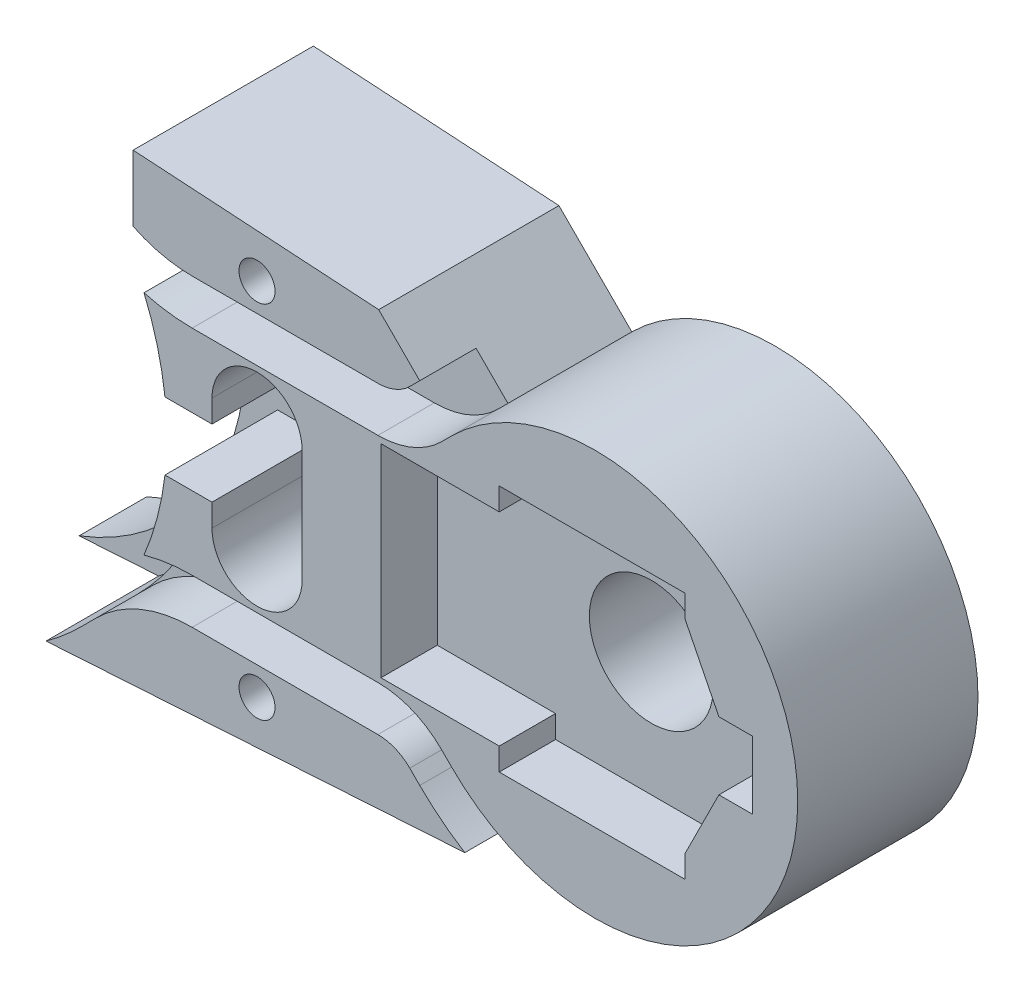
from build123d import *

# Parameters (mm, degrees)
SKETCH1_R                   = 2.75
BOSS_EXTRUDE1_DEPTH         = 8
POT_START                   = 8
POT_INSERT_DEPTH            = 2.5
MIDDLE_START                = 3
SKETCH7_R                   = 11
MIDDLE_FLEX_EXT_CANAL_DEPTH = 5
DISTAL_START                = 5.5
DISTAL_FLEX_EXT_CANAL_DEPTH = 2.5
SKETCH3_R                   = 0.8
SCREW_HOLES_DEPTH           = 44.132654063


with BuildPart() as part:
    # Sketch1 → Boss-Extrude1 (new body)
    with BuildSketch(Plane.XY):
        with BuildLine():
            Line((11.5, 10.28125), (11.5, 0))
            ThreePointArc((11.5, 0), (9.471532219, -6.522275479), (4.101725666, -10.743642146))
            Line((4.101725666, -10.743642146), (32, -9))
            ThreePointArc((32, -9), (40.314915793, 3.444150891), (25.636038969, 6.363961031))
            Line((25.636038969, 6.363961031), (22.4, 9.6))
            Line((22.4, 9.6), (11.5, 10.28125))
        make_face()
        with Locations((32, 0)):
            Circle(SKETCH1_R, mode=Mode.SUBTRACT)
    extrude(amount=BOSS_EXTRUDE1_DEPTH)

    # Sketch2 → Pot Insert (cut)
    with BuildSketch(Plane(origin=(28.28760271, 0, 0), x_dir=(1, 0, 0), z_dir=(0, 0, 1)).offset(POT_START)):
        Polygon((10.71239729, 0), (10.71239729, 1.5), (9.21239729, 1.5), (7.71239729, 4.5), (7.71239729, 5.5), (3.71239729, 5.5), (-0.53760271, 5.5), (-0.53760271, 4.5), (-5.78760271, 4.5), (-5.78760271, 0), (-5.78760271, -4.5), (-0.53760271, -4.5), (-0.53760271, -5.5), (3.71239729, -5.5), (7.71239729, -5.5), (7.71239729, -4.5), (9.21239729, -1.5), (10.71239729, -1.5), align=None)
    extrude(amount=-POT_INSERT_DEPTH, mode=Mode.SUBTRACT)

    # Sketch7 → Middle Flex/Ext Canal (cut)
    with BuildSketch(Plane.XY.offset(MIDDLE_START)):
        with BuildLine():
            ThreePointArc((19, 2.5), (17, 4.5), (15, 2.5))
            Line((15, 2.5), (15, 1.5))
            Line((15, 1.5), (12.91317157, 1.5))
            ThreePointArc((12.91317157, 1.5), (-13, 0), (12.91317157, -1.5))
            Line((12.91317157, -1.5), (15, -1.5))
            Line((15, -1.5), (15, -2.5))
            ThreePointArc((15, -2.5), (17, -4.5), (19, -2.5))
            Line((19, -2.5), (19, 2.5))
        make_face()
        Circle(SKETCH7_R, mode=Mode.SUBTRACT)
    extrude(amount=MIDDLE_FLEX_EXT_CANAL_DEPTH, mode=Mode.SUBTRACT)

    # Sketch6 → Distal Flex/Ext Canal (cut)
    with BuildSketch(Plane.XY.offset(DISTAL_START)):
        with BuildLine():
            ThreePointArc((8.463203436, 7.093145751), (11.058590226, 5.35896374), (14.120057685, 4.75))
            Line((14.120057685, 4.75), (22.365223689, 4.75))
            ThreePointArc((22.365223689, 4.75), (23.895957419, 5.05448187), (25.193650814, 5.921572875))
            Line((25.193650814, 5.921572875), (25.636038969, 6.363961031))
            Line((25.636038969, 6.363961031), (24.221825407, 7.778174593))
            Line((24.221825407, 7.778174593), (23.779437252, 7.335786438))
            ThreePointArc((23.779437252, 7.335786438), (23.130590554, 6.902240935), (22.365223689, 6.75))
            Line((22.365223689, 6.75), (14.120057685, 6.75))
            ThreePointArc((14.120057685, 6.75), (11.823957091, 7.206722805), (9.877416998, 8.507359313))
            Line((9.877416998, 8.507359313), (9.192388155, 9.192388155))
            Line((9.192388155, 9.192388155), (7.778174593, 7.778174593))
            Line((7.778174593, 7.778174593), (8.463203436, 7.093145751))
        make_face()
        with BuildLine():
            Line((1.369649805, -10.914396887), (7.633365377, -10.522914664))
            ThreePointArc((7.633365377, -10.522914664), (8.439139214, -9.888424006), (9.192388155, -9.192388155))
            Line((9.192388155, -9.192388155), (9.877416998, -8.507359313))
            ThreePointArc((9.877416998, -8.507359313), (11.823957091, -7.206722805), (14.120057685, -6.75))
            Line((14.120057685, -6.75), (22.365223689, -6.75))
            ThreePointArc((22.365223689, -6.75), (23.130590554, -6.902240935), (23.779437252, -7.335786438))
            Line((23.779437252, -7.335786438), (24.221825407, -7.778174593))
            ThreePointArc((24.221825407, -7.778174593), (25.176485851, -8.627841831), (26.223253078, -9.361046683))
            Line((26.223253078, -9.361046683), (32, -9))
            ThreePointArc((32, -9), (28.555849109, -8.314915793), (25.636038969, -6.363961031))
            Line((25.636038969, -6.363961031), (25.193650814, -5.921572875))
            ThreePointArc((25.193650814, -5.921572875), (23.895957419, -5.05448187), (22.365223689, -4.75))
            Line((22.365223689, -4.75), (14.120057685, -4.75))
            ThreePointArc((14.120057685, -4.75), (11.058590226, -5.35896374), (8.463203436, -7.093145751))
            Line((8.463203436, -7.093145751), (7.778174593, -7.778174593))
            ThreePointArc((7.778174593, -7.778174593), (4.835250291, -9.880301343), (1.369649805, -10.914396887))
        make_face()
    extrude(amount=DISTAL_FLEX_EXT_CANAL_DEPTH, mode=Mode.SUBTRACT)

    # Sketch3 → Screw Holes (cut, through all)
    with BuildSketch(Plane.XY):
        with Locations((17, 8)):
            Circle(SKETCH3_R)
        with Locations((17, -8)):
            Circle(SKETCH3_R)
        with Locations((17, 2.5)):
            Circle(SKETCH3_R)
        with Locations((17, -2.5)):
            Circle(SKETCH3_R)
    extrude(amount=SCREW_HOLES_DEPTH, mode=Mode.SUBTRACT)


solid = part.part
